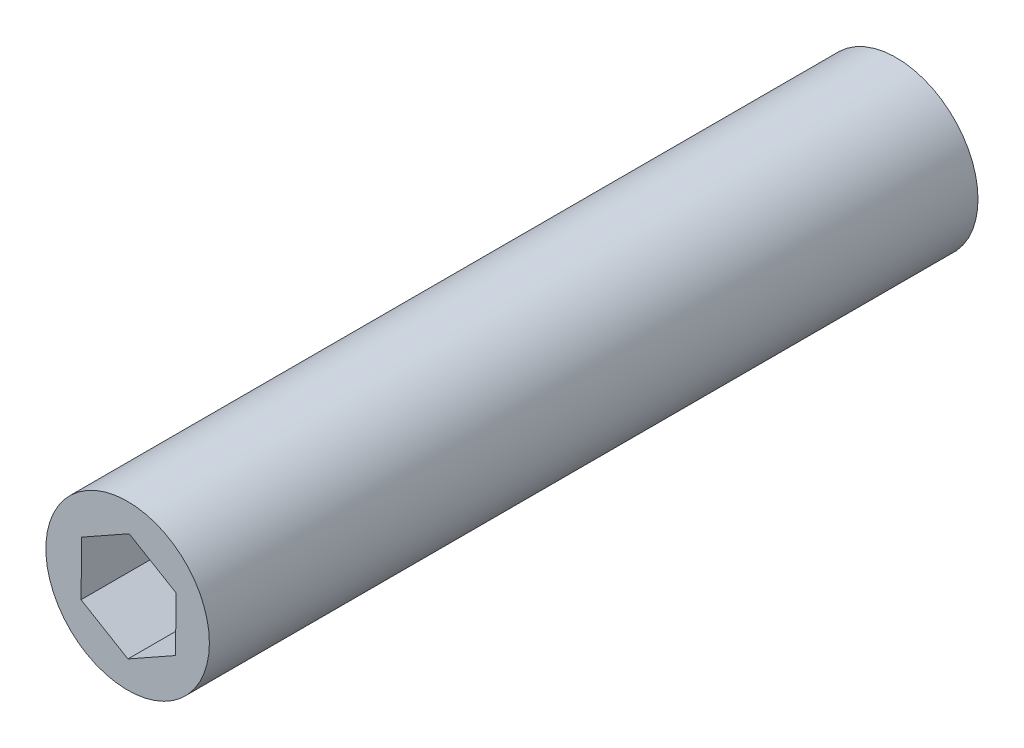
from build123d import *

# Parameters (mm, degrees)
SKETCH1_R          = 15
EXTRUDE1_DEPTH     = 141
EXTRUDE2_DEPTH     = 30
EXTRUDE3_DEPTH     = 30
SHELL5_START       = 30
SHELL5_OUTLINE_R   = 13
SHELL5_DEPTH       = 79
SHELL5_START_2     = 2
SHELL5_2_OUTLINE_R = 13
SHELL5_2_DEPTH     = 137
SHELL5_START_3     = 109
SHELL5_3_DEPTH     = 30
SHELL5_4_DEPTH     = 28
EXTRUDE4_DEPTH     = 2


# Read off the part's stored shape, not the designer's step: Shell5
with BuildPart() as part:
    # Sketch1 → Extrude1 (new body)
    with BuildSketch(Plane.XY):
        with Locations((-45.385330641, 54.653977414)):
            Circle(SKETCH1_R)
    extrude(amount=EXTRUDE1_DEPTH)

    # Sketch2 → Extrude2 (cut)
    with BuildSketch(Plane.XY.offset(141)):
        Polygon((-45.091602644, 64.656924427), (-53.813164855, 59.757219273), (-53.930676827, 49.754272261), (-45.326626587, 44.651030402), (-36.605064376, 49.550735556), (-36.487552404, 59.553682568), align=None)
    extrude(amount=-EXTRUDE2_DEPTH, mode=Mode.SUBTRACT)

    # Sketch5 → Extrude3 (cut)
    with BuildSketch(Plane(origin=(0, 0, 0), x_dir=(-1, 0, 0), z_dir=(0, 0, -1))):
        Polygon((45.385330641, 64.654606726), (36.724531603, 59.65429207), (36.724531603, 49.653662759), (45.385330641, 44.653348103), (54.046129679, 49.653662759), (54.046129679, 59.65429207), align=None)
    extrude(amount=-EXTRUDE3_DEPTH, mode=Mode.SUBTRACT)

    # Shell5 outline → Shell5 (cut)
    with BuildSketch(Plane.XY.offset(SHELL5_START)):
        with Locations((-45.385330641, 54.653977414)):
            Circle(SHELL5_OUTLINE_R)
    extrude(amount=SHELL5_DEPTH, mode=Mode.SUBTRACT)

    # Shell5 2 outline → Shell5 2 (cut)
    with BuildSketch(Plane.XY.offset(SHELL5_START_2)):
        with Locations((-45.385330641, 54.653977414)):
            Circle(SHELL5_2_OUTLINE_R)
        Polygon((-45.064474284, 66.966166161), (-34.474126219, 60.684809586), (-34.618766551, 48.37262084), (-45.353754947, 42.341788668), (-45.371174081, 42.35212032), (-45.385330641, 42.343947026), (-56.046129679, 48.49896222), (-56.046129679, 60.808992609), (-45.385330641, 66.964007803), (-45.228988272, 66.873743494), align=None, mode=Mode.SUBTRACT)
    extrude(amount=SHELL5_2_DEPTH, mode=Mode.SUBTRACT)

    # Shell5 3 outline → Shell5 3 (cut)
    with BuildSketch(Plane.XY.offset(SHELL5_START_3)):
        Polygon((-55.79946268, 60.935333989), (-45.228988272, 66.873743494), (-45.385330641, 66.964007803), (-56.046129679, 60.808992609), (-56.046129679, 48.49896222), (-45.385330641, 42.343947026), (-45.371174081, 42.35212032), (-55.944103012, 48.623145243), align=None)
    extrude(amount=SHELL5_3_DEPTH, mode=Mode.SUBTRACT)

    # Shell5 4 outline → Shell5 4 (cut)
    with BuildSketch(Plane.XY.offset(SHELL5_START_2)):
        Polygon((-34.618766551, 48.37262084), (-34.474126219, 60.684809586), (-45.064474284, 66.966166161), (-45.228988272, 66.873743494), (-34.724531603, 60.808992609), (-34.724531603, 48.49896222), (-45.371174081, 42.35212032), (-45.353754947, 42.341788668), align=None)
    extrude(amount=SHELL5_4_DEPTH, mode=Mode.SUBTRACT)

    # Sketch6 → Extrude4 (add)
    with BuildSketch(Plane.XY.offset(30)):
        Polygon((-34.724531603, 60.808992609), (-45.297222628, 66.811400248), (-55.78180564, 60.656385054), (-55.693697628, 48.49896222), (-45.121006603, 42.496554581), (-34.63642359, 48.651569775), align=None)
    extrude(amount=EXTRUDE4_DEPTH)


solid = part.part
